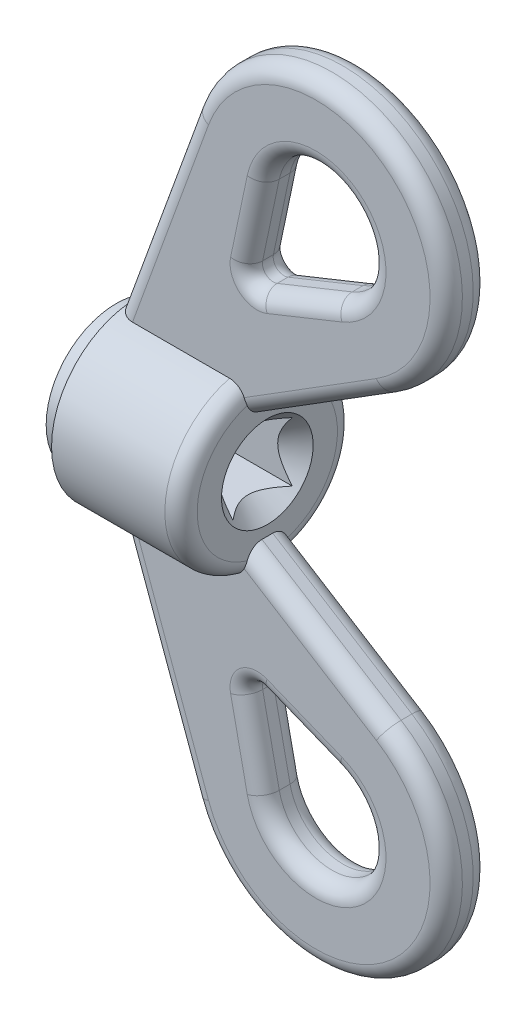
from build123d import *

# Parameters (mm, degrees)
BOSS_EXTRUDE7_DEPTH = 2
FILLET1_R           = 1.5
FILLET2_R           = 1.5
SKETCH8_W           = 5.5
SKETCH8_H           = 5.5
CUT_EXTRUDE2_DEPTH  = 41.932602208251375


with BuildPart() as part:
    # Sketch1 → Revolve1 (revolve)
    with BuildSketch(Plane.XY, mode=Mode.PRIVATE) as revolve1_sk:
        Polygon((0, 6.5), (2, 6.5), (2, 8), (14, 8), (14.000000000000002, 0), (3.500000000000001, 0), (3.500000000000001, 4.25), (0, 4.25), align=None)
    revolve(revolve1_sk.sketch.rotate(Axis((-7.430646831025688, 0, 0), (1, 0, 0)), 90), axis=Axis((-7.430646831025688, 0, 0), (1, 0, 0)))

    # Sketch2 → Boss-Extrude7 (add, symmetric)
    with BuildSketch(Plane.XY):
        with BuildLine():
            Line((9.145692876220155, 27.632629823772568), (1.9999999999999991, 8))
            Line((1.9999999999999991, 8), (1.9999999999999991, 5.190335075472997))
            Line((1.9999999999999991, 5.190335075472997), (13.999999999999998, 5.190335075472996))
            Line((13.999999999999998, 5.190335075472996), (26.903015139013274, 13.25303378306442))
            ThreePointArc((26.903015139013274, 13.25303378306442), (28.10407907988145, 32.890255633813254), (9.145692876220155, 27.632629823772568))
        make_face()
        with BuildLine():
            Line((15.606987907325461, 24.528801565386047), (14.067249978812832, 17.20576031307721))
            ThreePointArc((14.067249978812832, 17.20576031307721), (14.403064787661203, 16.23395555688102), (15.41841927556744, 16.071994654512363))
            Line((15.41841927556744, 16.071994654512363), (22.36283439109851, 18.859973272561824))
            ThreePointArc((22.36283439109851, 18.859973272561824), (23.71393804843267, 27.330222215594908), (15.606987907325461, 24.528801565386047))
        make_face(mode=Mode.SUBTRACT)
    extrude(amount=BOSS_EXTRUDE7_DEPTH, both=True)

    # Fillet1
    # the kernel refuses this fillet: 1.5 mm, written as the material it takes off along each edge
    with BuildSketch(Plane(origin=(15.045852397347742, 17.000000000000004, 2), x_dir=(-0.9786024185349075, 0.20576031307720596, 0), z_dir=(0.20576031307720596, 0.9786024185349075, 0))) as fillet1_piece_1:
        with BuildLine():
            CenterArc((1.0000000000000029 + FILLET1_R, -FILLET1_R), FILLET1_R, 90, 90)
            Line((1.0000000000000029 + FILLET1_R, 0), (1.0000000000000029, 0))
            Line((1.0000000000000029, 0), (1.0000000000000029, -FILLET1_R))
        make_face()
    revolve(axis=Axis((15.045852397347742, 17.000000000000004, 2), (0, 0, 1)), revolution_arc=123.74802133376333, mode=Mode.SUBTRACT)
    with BuildSketch(Plane(origin=(15.41841927556744, 16.071994654512363, 2), x_dir=(-4.9e-16, 1.22e-15, -1), z_dir=(0.9280053454876351, 0.37256687821970313, 0))) as fillet1_piece_2:
        with BuildLine():
            CenterArc((FILLET1_R, -FILLET1_R), FILLET1_R, 89.99999999999993, 89.99999999999993)
            Line((-1.97e-15, -FILLET1_R), (0, 0))
            Line((0, 0), (FILLET1_R, 0))
        make_face()
    extrude(amount=7.483162838767937, mode=Mode.SUBTRACT)
    with BuildSketch(Plane(origin=(15.606987907325461, 24.528801565386047, 2), x_dir=(0, 0, -1), z_dir=(-0.20576031307720943, -0.9786024185349067, 0))) as fillet1_piece_3:
        with BuildLine():
            CenterArc((FILLET1_R, -FILLET1_R), FILLET1_R, 90, 90)
            Line((0, -FILLET1_R), (0, 0))
            Line((0, 0), (FILLET1_R, 0))
        make_face()
    extrude(amount=7.4831628387679325, mode=Mode.SUBTRACT)
    with BuildSketch(Plane(origin=(20.499999999999993, 23.5, 2), x_dir=(0.37256687821970325, -0.928005345487635, 0), z_dir=(-0.928005345487635, -0.37256687821970325, 0))) as fillet1_piece_4:
        with BuildLine():
            CenterArc((5.000000000000001 + FILLET1_R, -FILLET1_R), FILLET1_R, 90.00000000000007, 89.99999999999994)
            Line((5.000000000000001 + FILLET1_R, 0), (5.000000000000001, 0))
            Line((5.000000000000001, 0), (5.000000000000003, -FILLET1_R))
        make_face()
    revolve(axis=Axis((20.499999999999993, 23.5, 2), (0, 0, 1)), revolution_arc=236.25197866623597, mode=Mode.SUBTRACT)
    with BuildSketch(Plane(origin=(20.499999999999993, 23.5, -2), x_dir=(0.37256687821970325, -0.928005345487635, 0), z_dir=(-0.928005345487635, -0.37256687821970325, 0))) as fillet1_piece_5:
        with BuildLine():
            CenterArc((5.000000000000001 + FILLET1_R, FILLET1_R), FILLET1_R, 180, 90)
            Line((4.999999999999995, FILLET1_R), (5.000000000000001, 0))
            Line((5.000000000000001, 0), (5.000000000000001 + FILLET1_R, 0))
        make_face()
    revolve(axis=Axis((20.499999999999993, 23.5, -2), (0, 0, 1)), revolution_arc=236.25197866623597, mode=Mode.SUBTRACT)
    with BuildSketch(Plane(origin=(15.045852397347742, 17.000000000000004, -2), x_dir=(-0.9786024185349075, 0.20576031307720596, 0), z_dir=(0.20576031307720596, 0.9786024185349075, 0))) as fillet1_piece_6:
        with BuildLine():
            CenterArc((1.0000000000000029 + FILLET1_R, FILLET1_R), FILLET1_R, 180, 90)
            Line((1.0000000000000029, FILLET1_R), (1.0000000000000029, 0))
            Line((1.0000000000000029, 0), (1.0000000000000029 + FILLET1_R, 0))
        make_face()
    revolve(axis=Axis((15.045852397347742, 17.000000000000004, -2), (0, 0, 1)), revolution_arc=123.74802133376333, mode=Mode.SUBTRACT)
    with BuildSketch(Plane(origin=(15.41841927556744, 16.071994654512363, -2), x_dir=(0.3725668782197031, -0.928005345487635, 0), z_dir=(0.9280053454876351, 0.37256687821970313, 0))) as fillet1_piece_7:
        with BuildLine():
            CenterArc((FILLET1_R, -FILLET1_R), FILLET1_R, 90, 90)
            Line((-1.97e-15, -FILLET1_R), (0, 0))
            Line((0, 0), (FILLET1_R, 0))
        make_face()
    extrude(amount=7.483162838767937, mode=Mode.SUBTRACT)
    with BuildSketch(Plane(origin=(15.606987907325461, 24.528801565386047, -2), x_dir=(-0.9786024185349067, 0.2057603130772094, 0), z_dir=(-0.20576031307720943, -0.9786024185349067, 0))) as fillet1_piece_8:
        with BuildLine():
            CenterArc((FILLET1_R, -FILLET1_R), FILLET1_R, 90, 90)
            Line((0, -FILLET1_R), (0, 0))
            Line((0, 0), (FILLET1_R, 0))
        make_face()
    extrude(amount=7.4831628387679325, mode=Mode.SUBTRACT)
    with BuildSketch(Plane(origin=(9.145692876220155, 27.632629823772568, -2), x_dir=(0.9396926207859081, -0.3420201433256697, 0), z_dir=(-0.3420201433256697, -0.9396926207859081, 0))) as fillet1_piece_9_section:
        with BuildLine():
            CenterArc((FILLET1_R, FILLET1_R), FILLET1_R, 180, 90)
            Line((-1.67e-15, FILLET1_R), (0, 0))
            Line((0, 0), (FILLET1_R, 0))
        make_face()
    fillet1_piece_9 = extrude(amount=27.26760827370646, mode=Mode.PRIVATE)
    fillet1_piece_9 = fillet1_piece_9 - Plane(origin=(9.145692876220155, 0, 0), x_dir=(0, 1.1e-16, 1), z_dir=(1, 0, 0)) * Cylinder(8, 61, mode=Mode.PRIVATE)
    add(fillet1_piece_9, mode=Mode.SUBTRACT)
    with BuildSketch(Plane(origin=(10.819819639413396, 3.2031378345984844, -2), x_dir=(4e-16, -6.4e-16, 1), z_dir=(0.8480480961564273, 0.529919264233203, 0))) as fillet1_piece_10_section:
        with BuildLine():
            CenterArc((FILLET1_R, -FILLET1_R), FILLET1_R, 89.99999999999996, 90.00000000000004)
            Line((-1.13e-15, -FILLET1_R), (0, 0))
            Line((0, 0), (FILLET1_R, 0))
        make_face()
    fillet1_piece_10 = extrude(amount=18.964956790178615, mode=Mode.PRIVATE)
    fillet1_piece_10 = split(fillet1_piece_10, bisect_by=Plane(origin=(14, 3.2031378345984844, -2), z_dir=(1, 0, 0)), keep=Keep.TOP, mode=Mode.PRIVATE)
    add(fillet1_piece_10, mode=Mode.SUBTRACT)
    with BuildSketch(Plane(origin=(20.5, 23.500000000000004, -2), x_dir=(0.5299192642332029, -0.8480480961564273, 0), z_dir=(-0.8480480961564273, -0.5299192642332029, 0))) as fillet1_piece_11:
        with BuildLine():
            CenterArc((12.083001262991425 - FILLET1_R, FILLET1_R), FILLET1_R, 270.0000000000002, 89.99999999999977)
            Line((12.083001262991425 - FILLET1_R, 0), (12.083001262991425, 0))
            Line((12.083001262991425, 0), (12.083001262991418, FILLET1_R))
        make_face()
    revolve(axis=Axis((20.5, 23.500000000000004, -2), (0, 0, 1)), revolution_arc=218.00000000000014, mode=Mode.SUBTRACT)
    with BuildSketch(Plane(origin=(9.145692876220155, 27.632629823772568, 2), x_dir=(0, 0, -1), z_dir=(-0.3420201433256697, -0.9396926207859081, 0))) as fillet1_piece_12_section:
        with BuildLine():
            CenterArc((FILLET1_R, FILLET1_R), FILLET1_R, 180.00000000000006, 89.99999999999994)
            Line((0, FILLET1_R), (0, 0))
            Line((0, 0), (FILLET1_R, 0))
        make_face()
    fillet1_piece_12 = extrude(amount=27.26760827370646, mode=Mode.PRIVATE)
    fillet1_piece_12 = fillet1_piece_12 - Plane(origin=(9.145692876220155, 0, 0), x_dir=(0, 1.1e-16, 1), z_dir=(1, 0, 0)) * Cylinder(8, 61, mode=Mode.PRIVATE)
    add(fillet1_piece_12, mode=Mode.SUBTRACT)
    with BuildSketch(Plane(origin=(10.819819639413396, 3.2031378345984844, 2), x_dir=(4e-16, -6.4e-16, -1), z_dir=(0.8480480961564273, 0.529919264233203, 0))) as fillet1_piece_13_section:
        with BuildLine():
            CenterArc((FILLET1_R, FILLET1_R), FILLET1_R, 180, 90.00000000000006)
            Line((-1.13e-15, FILLET1_R), (0, 0))
            Line((0, 0), (FILLET1_R, 0))
        make_face()
    fillet1_piece_13 = extrude(amount=18.964956790178615, mode=Mode.PRIVATE)
    fillet1_piece_13 = split(fillet1_piece_13, bisect_by=Plane(origin=(14, 3.2031378345984844, 2), z_dir=(1, 0, 0)), keep=Keep.TOP, mode=Mode.PRIVATE)
    add(fillet1_piece_13, mode=Mode.SUBTRACT)
    with BuildSketch(Plane(origin=(20.5, 23.500000000000004, 2), x_dir=(0.5299192642332029, -0.8480480961564273, 0), z_dir=(-0.8480480961564273, -0.5299192642332029, 0))) as fillet1_piece_14:
        with BuildLine():
            CenterArc((12.083001262991425 - FILLET1_R, -FILLET1_R), FILLET1_R, 0, 89.9999999999998)
            Line((12.083001262991425 - FILLET1_R, 0), (12.083001262991425, 0))
            Line((12.083001262991425, 0), (12.083001262991418, -FILLET1_R))
        make_face()
    revolve(axis=Axis((20.5, 23.500000000000004, 2), (0, 0, 1)), revolution_arc=218.00000000000014, mode=Mode.SUBTRACT)

    # Fillet2
    fillet2_edges = [part.edges().sort_by_distance(p)[0] for p in [
        (14, -8, 1.11e-15),
    ]]
    fillet(fillet2_edges, radius=FILLET2_R)

    # Mirror1: read off the stored shape, not the designer's step
    # Mirror1: part across plane


with BuildPart() as part_1:
    add(part.part)
    add(part.part.mirror(Plane.ZX))

    # Sketch8 → Cut-Extrude2 (cut, through all)
    with BuildSketch(Plane(origin=(14.000000000000002, 0, 0), x_dir=(0, 0, -1), z_dir=(1, 0, 0))):
        Rectangle(SKETCH8_W, SKETCH8_H)
    extrude(amount=-CUT_EXTRUDE2_DEPTH, mode=Mode.SUBTRACT)

    # Sketch11 → Cut-Revolve2 (revolve, cut)
    with BuildSketch(Plane(origin=(0, 0, 0), x_dir=(1, 0, 0), z_dir=(0, 1, 0)), mode=Mode.PRIVATE) as cut_revolve2_sk:
        Polygon((14.000000000000002, 2.7499999999999996), (12.212369611108668, 2.7499999999999996), (14.000000000000002, 4.25), align=None)
    revolve(cut_revolve2_sk.sketch.rotate(Axis((0, 0, 0), (1, 0, 0)), 315.000105402), axis=Axis((0, 0, 0), (1, 0, 0)), mode=Mode.SUBTRACT)


solid = part_1.part
